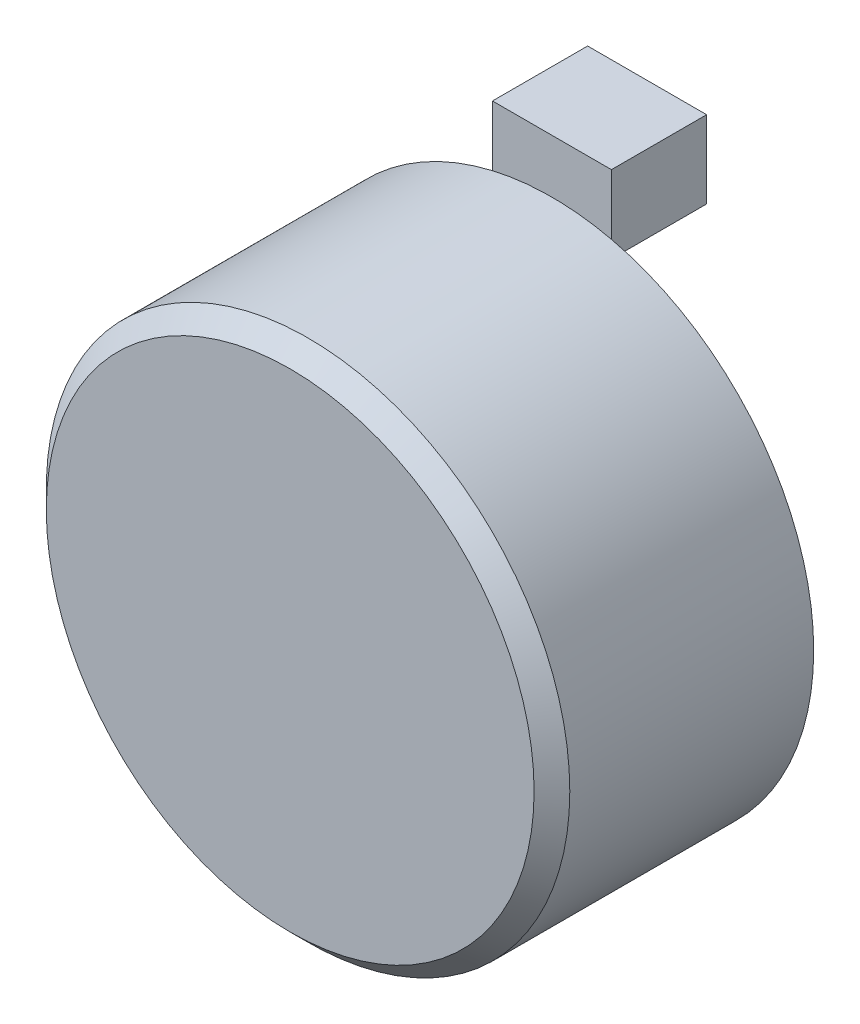
from build123d import *

# Parameters (mm, degrees)
SK_REARHOLE_R           = 1.25
REAR_TAPPED_HOLE_DEPTH  = 8
REAR_HOLE_PATTERN_COUNT = 6
SK_CONNECTOR_W          = 20
SK_CONNECTOR_H          = 13
CONNECTOR_ZONE_DEPTH    = 16


with BuildPart() as part:
    # SK_Body → Housing_Body (revolve)
    with BuildSketch(Plane(origin=(0, 0, 0), x_dir=(1, 0, 0), z_dir=(0, 1, 0))):
        Polygon((0, 0), (41, 0), (44, 3), (44, 44), (41, 44), (0, 44), align=None)
    revolve(axis=Axis((0, 0, 10), (0, 0, -1)))

    # SK_RearHole → Rear_Tapped_Hole (cut)
    with BuildSketch(Plane.XY.offset(-44)):
        with Locations((37, 0)):
            Circle(SK_REARHOLE_R)
    rear_tapped_hole = extrude(amount=REAR_TAPPED_HOLE_DEPTH, mode=Mode.SUBTRACT)

    # Rear_Hole_Pattern: Rear_Tapped_Hole ×6 about axis
    rear_hole_pattern_axis = Axis((0, 0, -63), (0, 0, 1))
    for i in range(1, REAR_HOLE_PATTERN_COUNT):
        add(rear_tapped_hole.rotate(rear_hole_pattern_axis, i * 360 / REAR_HOLE_PATTERN_COUNT), mode=Mode.SUBTRACT)

    # SK_Connector → Connector_Zone (add)
    with BuildSketch(Plane.XY.offset(-44)):
        with Locations((0, 46.5)):
            Rectangle(SK_CONNECTOR_W, SK_CONNECTOR_H)
    extrude(amount=-CONNECTOR_ZONE_DEPTH)


solid = part.part
